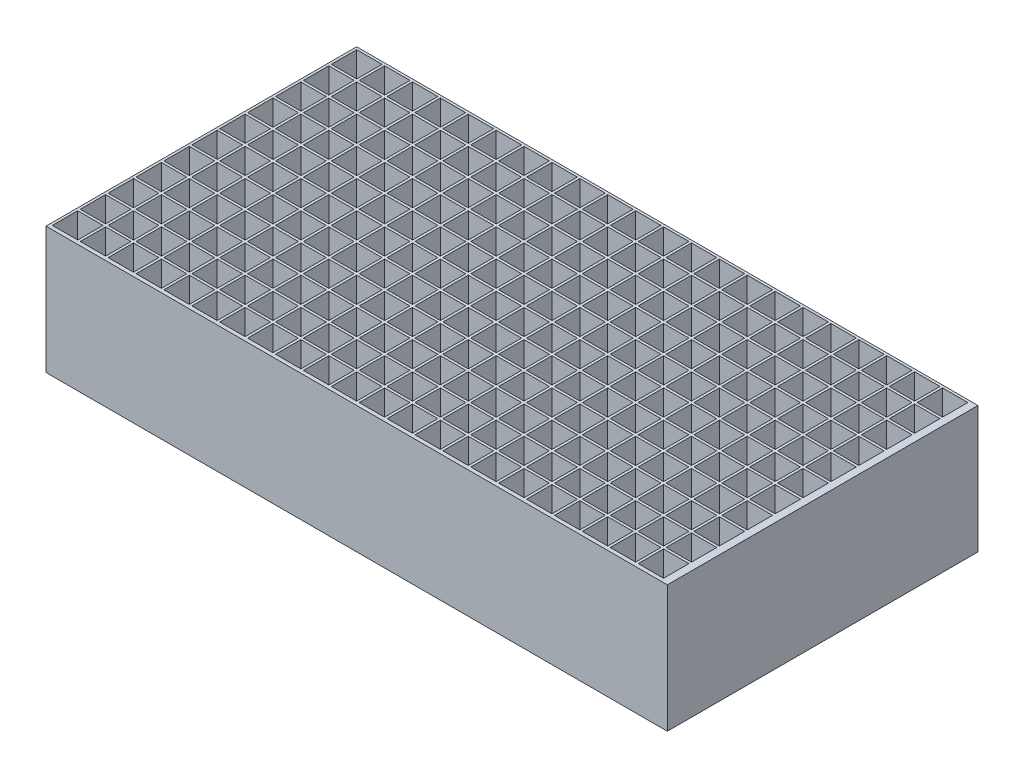
from build123d import *

# Parameters (mm, degrees)
SKETCH1_W            = 490
SKETCH1_H            = 245
BOSS_EXTRUDE1_DEPTH  = 100
SKETCH2_W            = 20
SKETCH2_H            = 20
CUT_EXTRUDE1_DEPTH   = 95
LPATTERN1_COUNT      = 22
LPATTERN1_PITCH      = 22
LPATTERN1_COUNT_DIR2 = 11
LPATTERN1_PITCH_DIR2 = 22


with BuildPart() as part:
    # Sketch1 → Boss-Extrude1 (new body)
    with BuildSketch(Plane(origin=(0, 0, 0), x_dir=(1, 0, 0), z_dir=(0, 1, 0))):
        Rectangle(SKETCH1_W, SKETCH1_H)
    extrude(amount=BOSS_EXTRUDE1_DEPTH)

    # Sketch2 → Cut-Extrude1 (cut)
    with BuildSketch(Plane(origin=(0, 100, 0), x_dir=(1, 0, 0), z_dir=(0, 1, 0))):
        with Locations((-233, 110.5)):
            Rectangle(SKETCH2_W, SKETCH2_H)
    cut_extrude1 = extrude(amount=-CUT_EXTRUDE1_DEPTH, mode=Mode.SUBTRACT)

    # LPattern1: Cut-Extrude1 22 × 11
    with Locations(*[(i * LPATTERN1_PITCH, 0, j * LPATTERN1_PITCH_DIR2) for i in range(LPATTERN1_COUNT) for j in range(LPATTERN1_COUNT_DIR2) if (i, j) != (0, 0)]):
        add(cut_extrude1, mode=Mode.SUBTRACT)


solid = part.part
